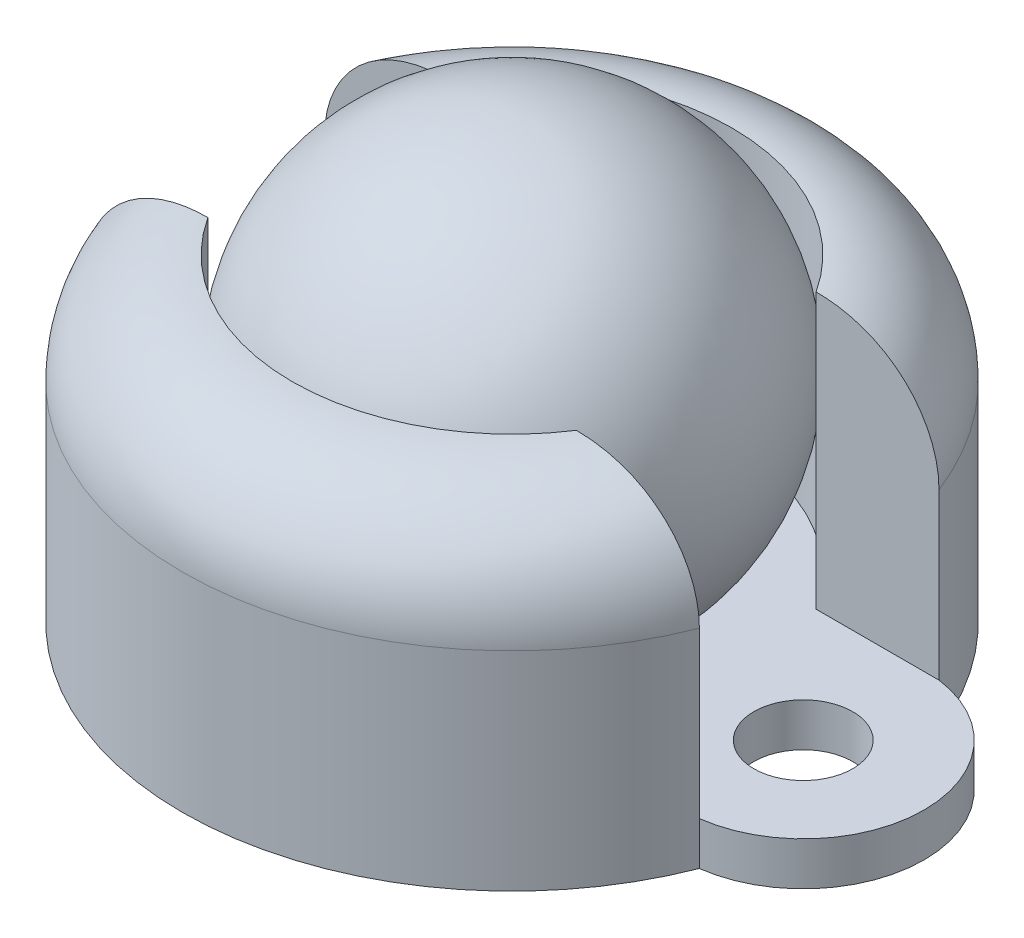
from build123d import *

# Parameters (mm, degrees)
SKETCH1_R           = 1.143
BOSS_EXTRUDE1_DEPTH = 1
BOSS_EXTRUDE2_DEPTH = 6.35
SKETCH4_R           = 3.110731253
CUT_EXTRUDE3_DEPTH  = 1
FILLET1_R           = 2.54


with BuildPart() as part:
    # Sketch1 → Boss-Extrude1 (new body)
    with BuildSketch(Plane(origin=(0, 0, 0), x_dir=(1, 0, 0), z_dir=(0, 1, 0))):
        with BuildLine():
            ThreePointArc((2.426179245, 10.389682995), (0, 7.62), (2.426179245, 4.850317005))
            ThreePointArc((2.426179245, 4.850317005), (9.525, 0), (16.623820755, 4.850317005))
            ThreePointArc((16.623820755, 4.850317005), (19.05, 7.62), (16.623820755, 10.389682995))
            ThreePointArc((16.623820755, 10.389682995), (9.525, 15.24), (2.426179245, 10.389682995))
        make_face()
        with Locations(Location((16.256, 7.62, 0), (0, 0, 270))):
            Circle(SKETCH1_R, mode=Mode.SUBTRACT)
        with Locations(Location((2.794, 7.62, 0), (0, 0, 270))):
            Circle(SKETCH1_R, mode=Mode.SUBTRACT)
    extrude(amount=BOSS_EXTRUDE1_DEPTH)

    # Sketch2 → Boss-Extrude2 (add)
    with BuildSketch(Plane(origin=(0, 1, 0), x_dir=(1, 0, 0), z_dir=(0, 1, 0))):
        with BuildLine():
            Line((2.426179245, 4.850317005), (5.26644906, 4.850317005))
            ThreePointArc((5.26644906, 4.850317005), (9.525, 2.54), (13.78355094, 4.850317005))
            Line((13.78355094, 4.850317005), (16.623820755, 4.850317005))
            ThreePointArc((16.623820755, 4.850317005), (9.525, 0), (2.426179245, 4.850317005))
        make_face()
        with BuildLine():
            Line((16.623820755, 10.389682995), (13.78355094, 10.389682995))
            ThreePointArc((13.78355094, 10.389682995), (9.525, 12.7), (5.26644906, 10.389682995))
            Line((5.26644906, 10.389682995), (2.426179245, 10.389682995))
            ThreePointArc((2.426179245, 10.389682995), (9.525, 15.24), (16.623820755, 10.389682995))
        make_face()
    extrude(amount=BOSS_EXTRUDE2_DEPTH)

    # Sketch4 → Cut-Extrude3 (cut)
    with BuildSketch(Plane.XZ):
        with Locations(Location((9.525, -7.62, 0), (0, 0, 270))):
            Circle(SKETCH4_R)
    extrude(amount=-CUT_EXTRUDE3_DEPTH, mode=Mode.SUBTRACT)

    # Fillet1
    fillet1_edges = [part.edges().sort_by_distance(p)[0] for p in [
        (9.525, 7.35, 0),
        (9.525, 7.35, -15.24),
    ]]
    fillet(fillet1_edges, radius=FILLET1_R - 0.0001)  # a hair under: the kernel refuses the full size


with BuildPart() as body_2:
    # Sketch3 → Revolve3 (revolve)
    with BuildSketch(Plane(origin=(0, 0, -7.62), x_dir=(-1, 0, 0), z_dir=(0, 0, -1))):
        with BuildLine():
            Line((-9.525, 0), (-9.525, 10.16))
            ThreePointArc((-9.525, 10.16), (-4.445, 5.08), (-9.525, 0))
        make_face()
    revolve(axis=Axis((9.525, 10.16, -7.62), (0, -1, 0)))


solid = Compound([part.part, body_2.part])
